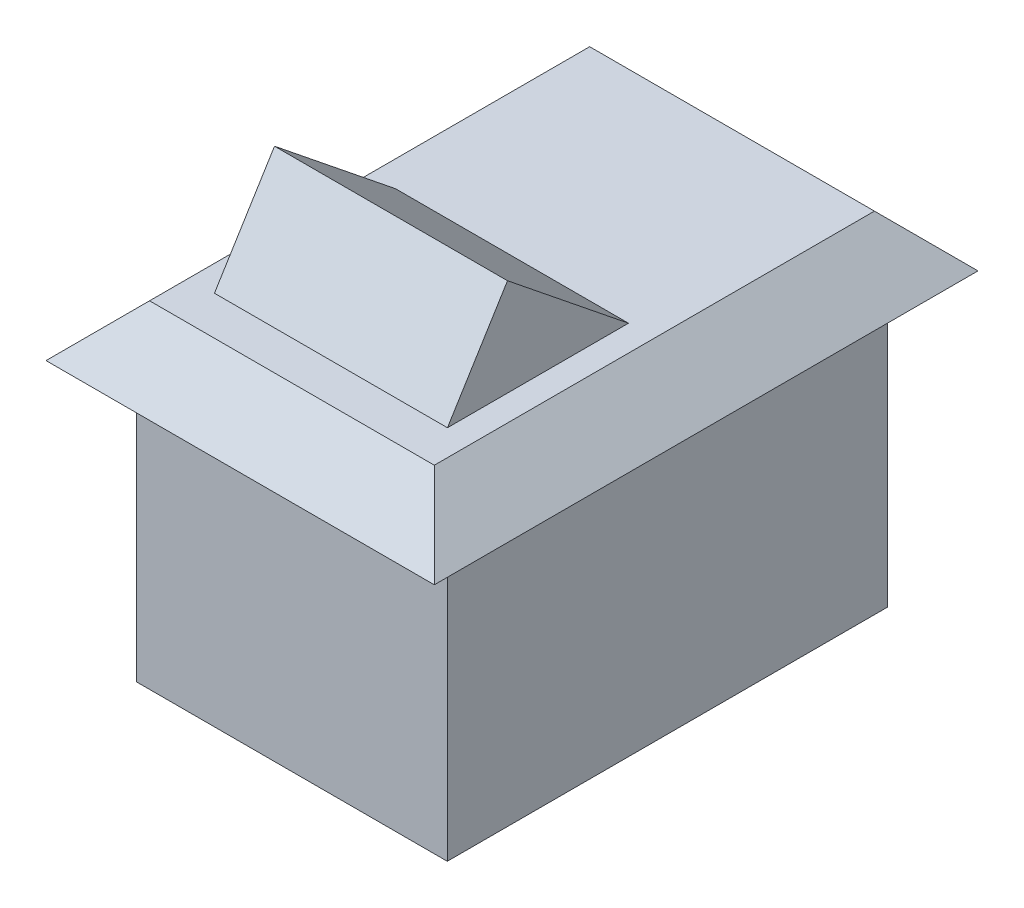
from build123d import *

# Parameters (mm, degrees)
SKETCH_1_W      = 12
SKETCH_1_H      = 17
EXTRUDE_1_DEPTH = 11
SKETCH_2_W      = 15
SKETCH_2_H      = 21
EXTRUDE_2_DEPTH = 2
CHAMFER_1_SIZE  = 2
EXTRUDE_3_DEPTH = 4.5


with BuildPart() as part:
    # 草图1 → 凸台-拉伸1 (new body)
    with BuildSketch(Plane(origin=(0, 0, 0), x_dir=(1, 0, 0), z_dir=(0, 1, 0))):
        Rectangle(SKETCH_1_W, SKETCH_1_H)
    extrude(amount=EXTRUDE_1_DEPTH)

    # 草图2 → 凸台-拉伸2 (add)
    with BuildSketch(Plane(origin=(0, 11, 0), x_dir=(1, 0, 0), z_dir=(0, 1, 0))):
        Rectangle(SKETCH_2_W, SKETCH_2_H)
    extrude(amount=EXTRUDE_2_DEPTH)

    # 倒角1
    chamfer_1_edges = [part.edges().sort_by_distance(p)[0] for p in [
        (0, 13, -10.5),
        (7.5, 13, 0),
        (0, 13, 10.5),
        (-7.5, 13, 0),
    ]]
    chamfer(chamfer_1_edges, length=CHAMFER_1_SIZE - 0.0001)  # a hair under: the kernel refuses the full size

    # 草图3 → 凸台-拉伸3 (add, symmetric)
    with BuildSketch(Plane(origin=(0, 0, 0), x_dir=(0, 0, -1), z_dir=(1, 0, 0))):
        Polygon((-6.993584735, 13), (-4.673908178, 16.758295881), (0, 13), align=None)
    extrude(amount=EXTRUDE_3_DEPTH, both=True)


solid = part.part
